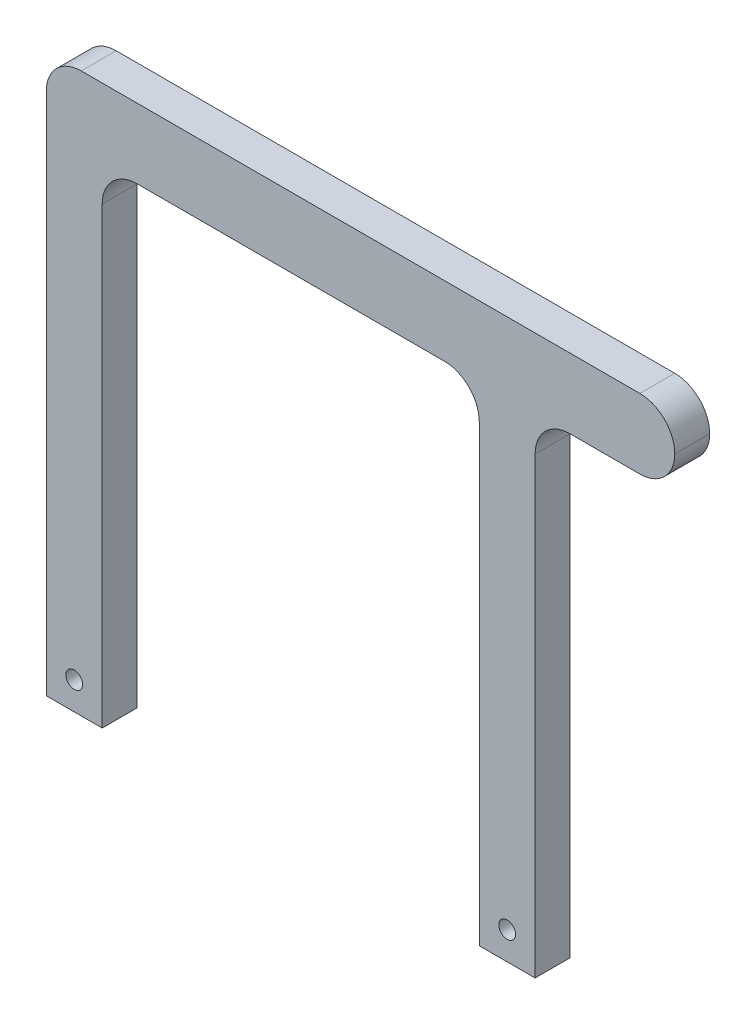
from build123d import *

# Parameters (mm, degrees)
ESQUISSE1_R          = 1
BOSS_EXTRU_1_DEPTH   = 5
D_GAGEMENT_M21_D     = 2.4
D_GAGEMENT_M21_DEPTH = 5
D_GAGEMENT_M21_TIP   = 0.721032743
CONG_1_START         = -1
CONG_1_DEPTH         = 7
CONG_1_2_DEPTH       = 5


with BuildPart() as part:
    # Esquisse1 → Boss.-Extru.1 (new body)
    with BuildSketch(Plane.XY):
        Polygon((0, 0), (0, 80), (90, 80), (90, 70), (70, 70), (70, 0), (62, 0), (62, 70), (8, 70), (8, 0), align=None)
        with Locations((4, 4)):
            Circle(ESQUISSE1_R, mode=Mode.SUBTRACT)
        with Locations((66, 4)):
            Circle(ESQUISSE1_R, mode=Mode.SUBTRACT)
    extrude(amount=BOSS_EXTRU_1_DEPTH)

    # Dégagement M21
    with Locations(Plane.XY.offset(5)):
        with Locations((4, 4), (66, 4)):
            Hole(D_GAGEMENT_M21_D / 2, depth=D_GAGEMENT_M21_DEPTH)
            with Locations((0, 0, -(D_GAGEMENT_M21_DEPTH + D_GAGEMENT_M21_TIP / 2))):  # 118° drill point
                Cone(0, D_GAGEMENT_M21_D / 2, D_GAGEMENT_M21_TIP, mode=Mode.SUBTRACT)

    # Congé1: read off the stored shape, not the designer's step
    # Congé1 outline → Congé1 (cut)
    with BuildSketch(Plane.XY.offset(CONG_1_START)):
        with BuildLine():
            Line((0, 80), (0, 75))
            ThreePointArc((0, 75), (1.464466094, 78.535533906), (5, 80))
            Line((5, 80), (0, 80))
        make_face()
        with BuildLine():
            Line((90, 70), (90, 75))
            ThreePointArc((90, 75), (88.535533906, 71.464466094), (85, 70))
            Line((85, 70), (90, 70))
        make_face()
        with BuildLine():
            Line((90, 80), (85, 80))
            ThreePointArc((85, 80), (88.535533906, 78.535533906), (90, 75))
            Line((90, 75), (90, 80))
        make_face()
    extrude(amount=CONG_1_DEPTH, mode=Mode.SUBTRACT)

    # Cong_1 2 outline → Cong_1 2 (add)
    with BuildSketch(Plane.XY):
        with BuildLine():
            ThreePointArc((70, 65), (71.464466094, 68.535533906), (75, 70))
            Line((75, 70), (70, 70))
            Line((70, 70), (70, 65))
        make_face()
        with BuildLine():
            ThreePointArc((8, 65), (9.464466094, 68.535533906), (13, 70))
            Line((13, 70), (8, 70))
            Line((8, 70), (8, 65))
        make_face()
        with BuildLine():
            ThreePointArc((57, 70), (60.535533906, 68.535533906), (62, 65))
            Line((62, 65), (62, 70))
            Line((62, 70), (57, 70))
        make_face()
    extrude(amount=CONG_1_2_DEPTH)


solid = part.part
